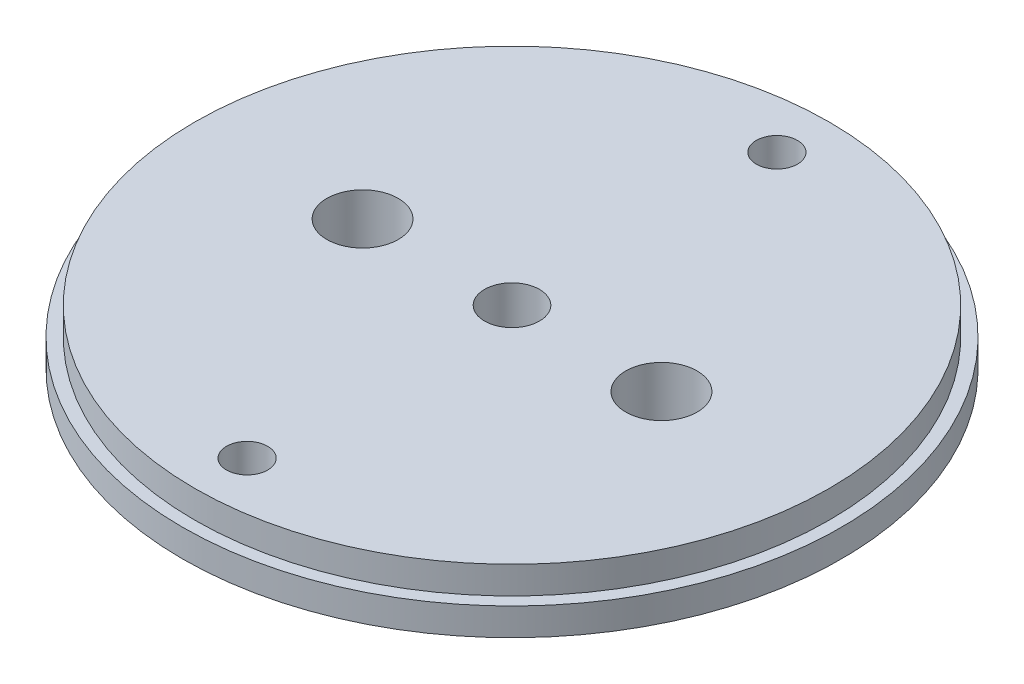
from build123d import *

# Parameters (mm, degrees)
SKETCH1_R           = 76.1746
BOSS_EXTRUDE1_DEPTH = 6.35
SKETCH1_3_R         = 73.3425
BOSS_EXTRUDE2_DEPTH = 12.7
SKETCH3_R           = 6.35
SKETCH3_R_2         = 8.250047
SKETCH3_R_3         = 4.7625
CUT_EXTRUDE1_DEPTH  = 109.473173505


with BuildPart() as part:
    # Sketch1 → Boss-Extrude1 (new body)
    with BuildSketch(Plane(origin=(0, 0, 0), x_dir=(1, 0, 0), z_dir=(0, 1, 0))):
        Circle(SKETCH1_R)
    extrude(amount=BOSS_EXTRUDE1_DEPTH)

    # Sketch1<3> → Boss-Extrude2 (add)
    with BuildSketch(Plane(origin=(0, 0, 0), x_dir=(1, 0, 0), z_dir=(0, 1, 0))):
        Circle(SKETCH1_3_R)
    extrude(amount=BOSS_EXTRUDE2_DEPTH)

    # Sketch3 → Cut-Extrude1 (cut, through all)
    with BuildSketch(Plane.XZ):
        Circle(SKETCH3_R)
        with Locations((-34.545265195, 0)):
            Circle(SKETCH3_R_2)
        with Locations((34.545265195, 0)):
            Circle(SKETCH3_R_2)
        with Locations((0, 61.227285883)):
            Circle(SKETCH3_R_3)
        with Locations((0, -61.227285883)):
            Circle(SKETCH3_R_3)
    extrude(amount=-CUT_EXTRUDE1_DEPTH, mode=Mode.SUBTRACT)


solid = part.part
